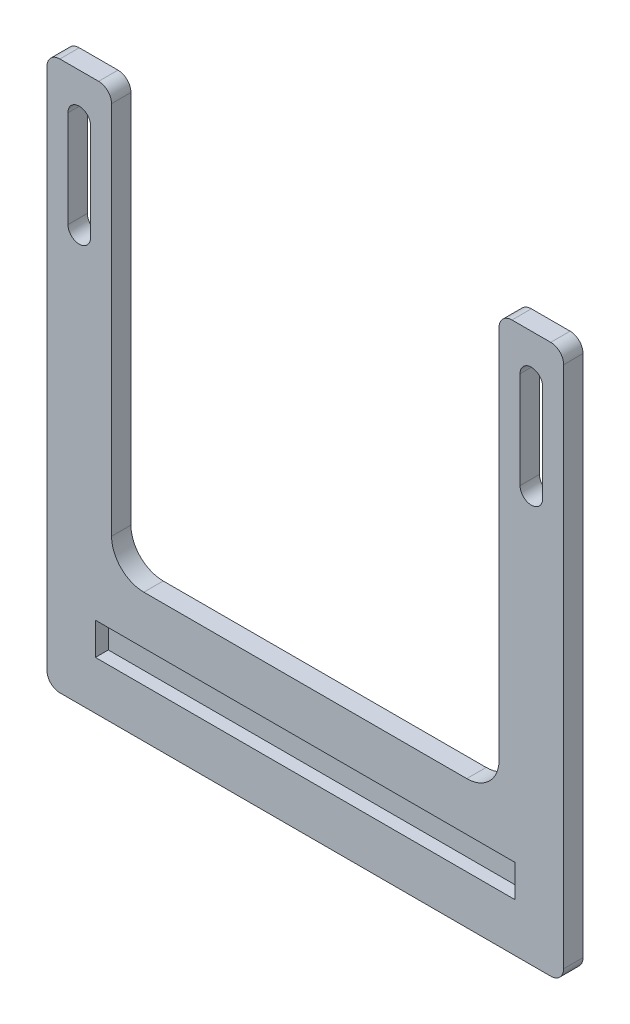
from build123d import *

# Parameters (mm, degrees)
CROQUIS1_W              = 65
CROQUIS1_H              = 5
SALIENTE_EXTRUIR1_DEPTH = 3
CROQUIS1_3_W            = 65
CROQUIS1_3_H            = 5
SALIENTE_EXTRUIR2_DEPTH = 1
REDONDEO1_R             = 5
REDONDEO2_R             = 2


with BuildPart() as part:
    # Croquis1 → Saliente-Extruir1 (new body)
    with BuildSketch(Plane.XY):
        Polygon((-30, 10), (30, 10), (30, 75), (40, 75), (40, 10), (40, -10), (-40, -10), (-40, 10), (-40, 75), (-30, 75), align=None)
        with BuildLine():
            Line((-33.25, 68.415525287), (-33.25, 53.415525287))
            ThreePointArc((-33.25, 53.415525287), (-35, 51.665525287), (-36.75, 53.415525287))
            Line((-36.75, 53.415525287), (-36.75, 68.415525287))
            ThreePointArc((-36.75, 68.415525287), (-35, 70.165525287), (-33.25, 68.415525287))
        make_face(mode=Mode.SUBTRACT)
        with BuildLine():
            Line((33.25, 68.415525287), (33.25, 53.415525287))
            ThreePointArc((33.25, 53.415525287), (35, 51.665525287), (36.75, 53.415525287))
            Line((36.75, 53.415525287), (36.75, 68.415525287))
            ThreePointArc((36.75, 68.415525287), (35, 70.165525287), (33.25, 68.415525287))
        make_face(mode=Mode.SUBTRACT)
        Rectangle(CROQUIS1_W, CROQUIS1_H, mode=Mode.SUBTRACT)
    extrude(amount=SALIENTE_EXTRUIR1_DEPTH)

    # Croquis1<3> → Saliente-Extruir2 (add)
    with BuildSketch(Plane.XY):
        Rectangle(CROQUIS1_3_W, CROQUIS1_3_H)
    extrude(amount=SALIENTE_EXTRUIR2_DEPTH)

    # Redondeo1
    redondeo1_edges = [part.edges().sort_by_distance(p)[0] for p in [
        (30, 10, 1.5),
        (-30, 10, 1.5),
    ]]
    fillet(redondeo1_edges, radius=REDONDEO1_R)

    # Redondeo2
    redondeo2_edges = [part.edges().sort_by_distance(p)[0] for p in [
        (40, -10, 1.5),
        (-40, -10, 1.5),
        (40, 75, 1.5),
        (30, 75, 1.5),
        (-40, 75, 1.5),
        (-30, 75, 1.5),
    ]]
    fillet(redondeo2_edges, radius=REDONDEO2_R)


solid = part.part
